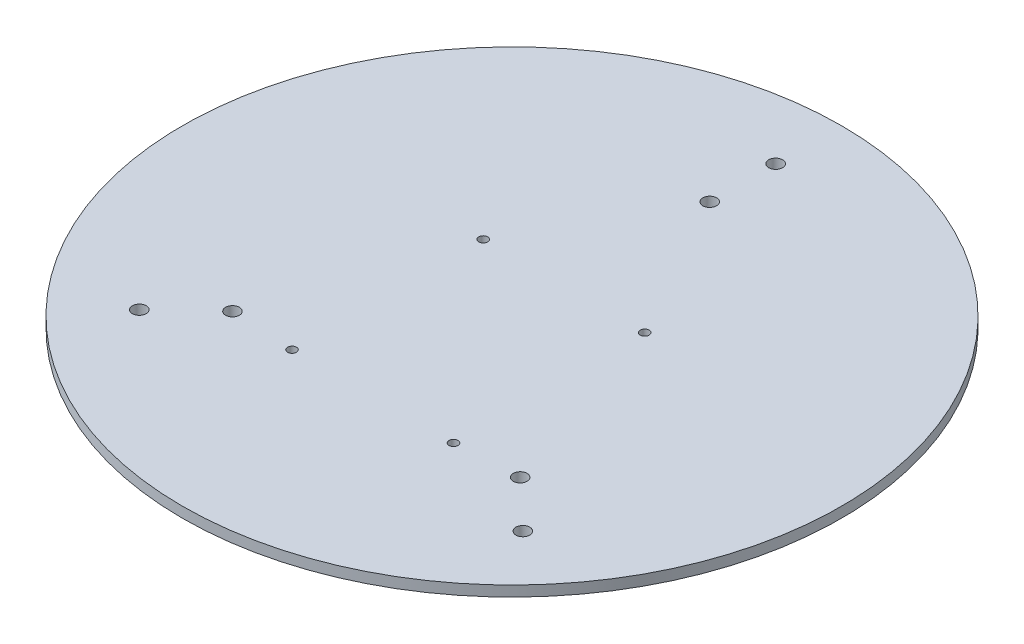
from build123d import *

# Parameters (mm, degrees)
SKETCH1_R           = 100
SKETCH1_R_2         = 1.35
SKETCH1_R_3         = 2.1
BOSS_EXTRUDE1_DEPTH = 3.175


with BuildPart() as part:
    # Sketch1 → Boss-Extrude1 (new body)
    with BuildSketch(Plane(origin=(0, 0, 0), x_dir=(1, 0, 0), z_dir=(0, 1, 0))):
        Circle(SKETCH1_R)
        with Locations((-24.5, -42.25)):
            Circle(SKETCH1_R_2, mode=Mode.SUBTRACT)
        with Locations((24.5, -42.25)):
            Circle(SKETCH1_R_2, mode=Mode.SUBTRACT)
        with Locations((24.5, 15.75)):
            Circle(SKETCH1_R_2, mode=Mode.SUBTRACT)
        with Locations((-24.5, 15.75)):
            Circle(SKETCH1_R_2, mode=Mode.SUBTRACT)
        with Locations((0, 80)):
            Circle(SKETCH1_R_3, mode=Mode.SUBTRACT)
        with Locations((0, 60)):
            Circle(SKETCH1_R_3, mode=Mode.SUBTRACT)
        with Locations((43.642418504, -41.174498262)):
            Circle(SKETCH1_R_3, mode=Mode.SUBTRACT)
        with Locations((58.189891339, -54.899331016)):
            Circle(SKETCH1_R_3, mode=Mode.SUBTRACT)
        with Locations((-58.189891339, -54.899331016)):
            Circle(SKETCH1_R_3, mode=Mode.SUBTRACT)
        with Locations((-43.642418504, -41.174498262)):
            Circle(SKETCH1_R_3, mode=Mode.SUBTRACT)
    extrude(amount=BOSS_EXTRUDE1_DEPTH)


solid = part.part
